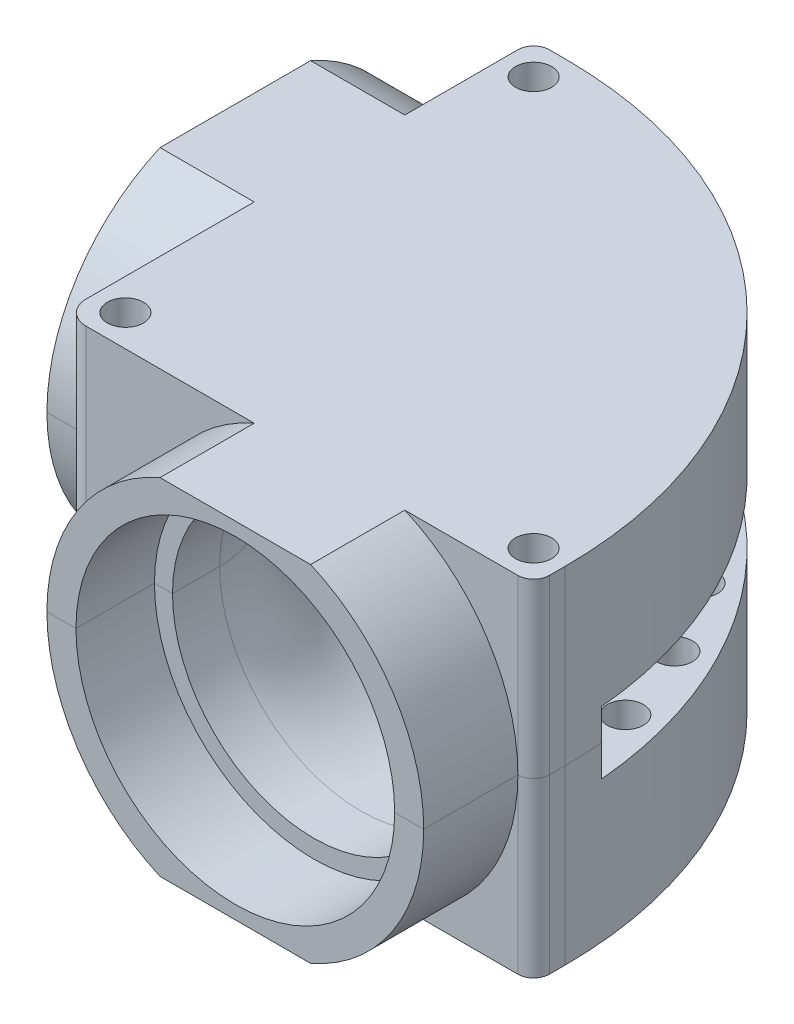
from build123d import *

# Parameters (mm, degrees)
EXTRUDE_1_DEPTH          = 11
SWEEP_2_PROFILE_R        = 9
SKETCH_16_W              = 26
SKETCH_16_H              = 22
SKETCH_16_R              = 9
EXTRUDE_3_DEPTH          = 2
SKETCH_17_W              = 26
SKETCH_17_H              = 22
SKETCH_17_R              = 9
EXTRUDE_4_DEPTH          = 2
SKETCH_18_R              = 9
EXTRUDE_5_DEPTH          = 6
SKETCH_19_R              = 9
EXTRUDE_6_DEPTH          = 6
EXTRUDE_8_DEPTH          = 11
EXTRUDE_8_DEPTH_BACK     = 11
CUT_EXTRUDE_1_DEPTH      = 14
CUT_EXTRUDE_1_DEPTH_BACK = 13
SKETCH_23_R              = 1.15
CUT_EXTRUDE_2_DEPTH      = 11
CUT_EXTRUDE_2_DEPTH_BACK = 11
SKETCH_24_R              = 1.15
CUT_EXTRUDE_3_DEPTH      = 11
CUT_EXTRUDE_3_DEPTH_BACK = 11
SKETCH_25_R              = 1.15
CUT_EXTRUDE_6_DEPTH      = 2
CUT_EXTRUDE_6_DEPTH_BACK = 2
CUT_EXTRUDE_7_DEPTH      = 8
CUT_EXTRUDE_7_DEPTH_BACK = 8
SKETCH_27_R              = 1.15
SKETCH_28_R              = 10.15
CUT_EXTRUDE_8_DEPTH      = 5
FILLET_1_R               = 1.5
FILLET_2_R               = 1
SKETCH_29_R              = 10.15
CUT_EXTRUDE_10_DEPTH     = 5


with BuildPart() as part:
    # 草图1 → 凸台-拉伸1 (new, symmetric)
    with BuildSketch(Plane(origin=(0, 0, 0), x_dir=(1, 0, 0), z_dir=(0, 1, 0))):
        with BuildLine():
            Line((2, 0), (28, 0))
            ThreePointArc((28, 0), (19.798989873, 19.798989873), (0, 28))
            Line((0, 28), (0, 2))
            ThreePointArc((0, 2), (1.414213562, 1.414213562), (2, 0))
        make_face()
    extrude(amount=EXTRUDE_1_DEPTH, both=True)

    # 切除-扫描2: sweep along a path in 草图9
    with BuildLine(Plane(origin=(0, 0, 0), x_dir=(1, 0, 0), z_dir=(0, 1, 0))) as sweep_2_path:
        CenterArc((0, 0), 15, 0, 360)
    # 切除-扫描2 profile (on start of the path) → 切除-扫描2 (sweep, cut)
    with BuildSketch(Plane(origin=(15, 0, 0), x_dir=(-1, 0, 0), z_dir=(0, 0, -1))):
        Circle(SWEEP_2_PROFILE_R)
    sweep(path=sweep_2_path.line, mode=Mode.SUBTRACT)

    # 草图16 → 凸台-拉伸3 (add)
    with BuildSketch(Plane.XY):
        with Locations((15, 0)):
            Rectangle(SKETCH_16_W, SKETCH_16_H)
        with Locations((15, 0)):
            Circle(SKETCH_16_R, mode=Mode.SUBTRACT)
    extrude(amount=EXTRUDE_3_DEPTH)

    # 草图17 → 凸台-拉伸4 (add)
    with BuildSketch(Plane.ZY):
        with Locations((-15, 0)):
            Rectangle(SKETCH_17_W, SKETCH_17_H)
        with Locations(Location((-15, 0, 0), (0, 0, 180))):
            Circle(SKETCH_17_R, mode=Mode.SUBTRACT)
    extrude(amount=EXTRUDE_4_DEPTH)

    # 草图18 → 凸台-拉伸5 (add)
    with BuildSketch(Plane.XY.offset(2)):
        with BuildLine():
            Line((10.204168477, 11), (19.795831523, 11))
            ThreePointArc((19.795831523, 11), (27, 0), (19.795831523, -11))
            Line((19.795831523, -11), (10.204168477, -11))
            ThreePointArc((10.204168477, -11), (3, 0), (10.204168477, 11))
        make_face()
        with Locations((15, 0)):
            Circle(SKETCH_18_R, mode=Mode.SUBTRACT)
    extrude(amount=EXTRUDE_5_DEPTH)

    # 草图19 → 凸台-拉伸6 (add)
    with BuildSketch(Plane.ZY.offset(2)):
        with BuildLine():
            Line((-19.795831523, 11), (-10.204168477, 11))
            ThreePointArc((-10.204168477, 11), (-3, 0), (-10.204168477, -11))
            Line((-10.204168477, -11), (-19.795831523, -11))
            ThreePointArc((-19.795831523, -11), (-27, 0), (-19.795831523, 11))
        make_face()
        with Locations(Location((-15, 0, 0), (0, 0, 180))):
            Circle(SKETCH_19_R, mode=Mode.SUBTRACT)
    extrude(amount=EXTRUDE_6_DEPTH)

    # 草图21 → 凸台-拉伸8 (add, two sides: drawn at the far end of the back side and taken through both)
    with BuildSketch(Plane(origin=(0, 0, 0), x_dir=(1, 0, 0), z_dir=(0, 1, 0)).offset(-EXTRUDE_8_DEPTH_BACK)):
        with BuildLine():
            Line((-2, 2), (-2, -2))
            Line((-2, -2), (2, -2))
            Line((2, -2), (2, 0))
            ThreePointArc((2, 0), (1.414213562, 1.414213562), (0, 2))
            Line((0, 2), (-2, 2))
        make_face()
    extrude(amount=EXTRUDE_8_DEPTH + EXTRUDE_8_DEPTH_BACK)

    # 草图23 → 切除-拉伸1 (cut, two sides: drawn at the far end of the back side and taken through both)
    with BuildSketch(Plane(origin=(0, 0, 0), x_dir=(1, 0, 0), z_dir=(0, 1, 0)).offset(-CUT_EXTRUDE_1_DEPTH_BACK)):
        with Locations(Location((0, 0, 0), (0, 0, 270))):
            Circle(SKETCH_23_R)
    extrude(amount=CUT_EXTRUDE_1_DEPTH + CUT_EXTRUDE_1_DEPTH_BACK, mode=Mode.SUBTRACT)

    # 草图24 → 切除-拉伸2 (cut, two sides: drawn at the far end of the back side and taken through both)
    with BuildSketch(Plane(origin=(0, 0, 0), x_dir=(1, 0, 0), z_dir=(0, 1, 0)).offset(-CUT_EXTRUDE_2_DEPTH_BACK)):
        with Locations(Location((26, 0, 0), (0, 0, 270))):
            Circle(SKETCH_24_R)
    extrude(amount=CUT_EXTRUDE_2_DEPTH + CUT_EXTRUDE_2_DEPTH_BACK, mode=Mode.SUBTRACT)

    # 草图25 → 切除-拉伸3 (cut, two sides: drawn at the far end of the back side and taken through both)
    with BuildSketch(Plane(origin=(0, 0, 0), x_dir=(1, 0, 0), z_dir=(0, 1, 0)).offset(-CUT_EXTRUDE_3_DEPTH_BACK)):
        with Locations(Location((0, 26, 0), (0, 0, 270))):
            Circle(SKETCH_25_R)
    extrude(amount=CUT_EXTRUDE_3_DEPTH + CUT_EXTRUDE_3_DEPTH_BACK, mode=Mode.SUBTRACT)

    # 草图26 → 切除-拉伸6 (cut, two sides: drawn at the far end of the back side and taken through both)
    with BuildSketch(Plane(origin=(0, 0, 0), x_dir=(1, 0, 0), z_dir=(0, 1, 0)).offset(-CUT_EXTRUDE_6_DEPTH_BACK)):
        with BuildLine():
            Line((19.923893962, 1.743114855), (29.885840943, 2.614672282))
            ThreePointArc((29.885840943, 2.614672282), (21.213203436, 21.213203436), (2.614672282, 29.885840943))
            Line((2.614672282, 29.885840943), (1.743114855, 19.923893962))
            ThreePointArc((1.743114855, 19.923893962), (14.142135624, 14.142135624), (19.923893962, 1.743114855))
        make_face()
    extrude(amount=CUT_EXTRUDE_6_DEPTH + CUT_EXTRUDE_6_DEPTH_BACK, mode=Mode.SUBTRACT)

    # 草图27 → 切除-拉伸7 (cut, two sides: drawn at the far end of the back side and taken through both)
    with BuildSketch(Plane(origin=(0, 0, 0), x_dir=(1, 0, 0), z_dir=(0, 1, 0)).offset(-CUT_EXTRUDE_7_DEPTH_BACK)):
        with Locations(Location((25.114071484, 6.729295173, 0), (0, 0, 270))):
            Circle(SKETCH_27_R)
        with Locations(Location((23.166169629, 11.803752993, 0), (0, 0, 270))):
            Circle(SKETCH_27_R)
        with Locations(Location((20.205794998, 16.362330167, 0), (0, 0, 270))):
            Circle(SKETCH_27_R)
        with Locations(Location((6.729295173, 25.114071484, 0), (0, 0, 90))):
            Circle(SKETCH_27_R)
        with Locations(Location((11.803752993, 23.166169629, 0), (0, 0, 90))):
            Circle(SKETCH_27_R)
        with Locations(Location((16.362330167, 20.205794998, 0), (0, 0, 90))):
            Circle(SKETCH_27_R)
    extrude(amount=CUT_EXTRUDE_7_DEPTH + CUT_EXTRUDE_7_DEPTH_BACK, mode=Mode.SUBTRACT)

    # 草图28 → 切除-拉伸8 (cut)
    with BuildSketch(Plane.XY.offset(8)):
        with Locations((15, 0)):
            Circle(SKETCH_28_R)
    extrude(amount=-CUT_EXTRUDE_8_DEPTH, mode=Mode.SUBTRACT)

    # 圆角1
    fillet_1_edges = [part.edges().sort_by_distance(p)[0] for p in [
        (-2, 0, 2),
    ]]
    fillet(fillet_1_edges, radius=FILLET_1_R)

    # 圆角2
    fillet_2_edges = [part.edges().sort_by_distance(p)[0] for p in [
        (28, 0, 2),
        (-2, 0, -28),
    ]]
    fillet(fillet_2_edges, radius=FILLET_2_R - 0.0001)  # a hair under: the kernel refuses the full size

    # 草图29 → 切除-拉伸10 (cut)
    with BuildSketch(Plane.ZY.offset(8)):
        with Locations((-15, 0)):
            Circle(SKETCH_29_R)
    extrude(amount=-CUT_EXTRUDE_10_DEPTH, mode=Mode.SUBTRACT)


with BuildPart() as body_2:
    # Split Bodies 1: the piece on the far side of the plane
    add(part.part)
    split(bisect_by=Plane.ZX, keep=Keep.BOTTOM)


with BuildPart() as part_1:
    add(part.part)

    # Split Bodies 1
    split(bisect_by=Plane.ZX, keep=Keep.TOP)


solid = Compound([body_2.part, part_1.part])
